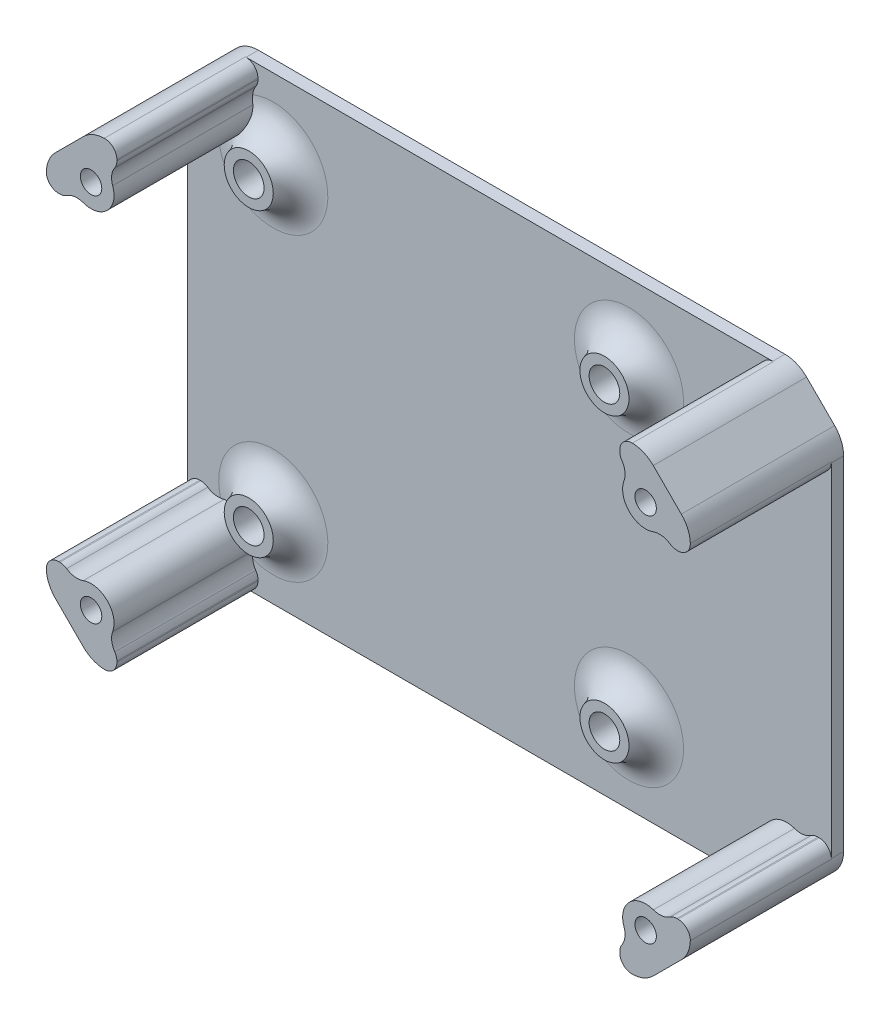
from build123d import *

# Parameters (mm, degrees)
EXTRUDE_1_DEPTH     = 25
SKETCH_2_R          = 1.75
CUT_EXTRUDE_1_DEPTH = 34
SHELL_1_T           = -2
FILLET_1_R          = 10
FILLET_2_R          = 3
FILLET_3_R          = 5
SKETCH_4_W          = 82
SKETCH_4_H          = 126.745531776
CUT_EXTRUDE_2_DEPTH = 23
FILLET_4_R          = 2
SKETCH_5_W          = 173.89587329
SKETCH_5_H          = 52
CUT_EXTRUDE_3_DEPTH = 23
FILLET_5_R          = 2
SKETCH_6_R          = 4
EXTRUDE_2_DEPTH     = 4
SKETCH_7_R          = 2.5
CUT_EXTRUDE_4_DEPTH = 6
FILLET_6_R          = 5


with BuildPart() as part:
    # Эскиз1 → Бобышка-Вытянуть1 (new body)
    with BuildSketch(Plane.XY):
        Polygon((-52.5, 30), (-45, 37.5), (45, 37.5), (52.5, 30), (52.5, -30), (45, -37.5), (-45, -37.5), (-52.5, -30), align=None)
    extrude(amount=EXTRUDE_1_DEPTH)

    # Эскиз2 → Вырез-Вытянуть1 (cut)
    with BuildSketch(Plane.XY.offset(25)):
        with Locations((-45.214466094, 30.214466094)):
            Circle(SKETCH_2_R)
        with Locations(Location((45.214466094, 30.214466094, 0), (0, 0, 180))):
            Circle(SKETCH_2_R)
        with Locations((45.214466094, -30.214466094)):
            Circle(SKETCH_2_R)
        with Locations(Location((-45.214466094, -30.214466094, 0), (0, 0, 180))):
            Circle(SKETCH_2_R)
    extrude(amount=-CUT_EXTRUDE_1_DEPTH, mode=Mode.SUBTRACT)

    # Оболочка1
    shell_1_openings = [part.faces().sort_by_distance(p)[0] for p in [
        (0, 0, 25),
    ]]
    offset(amount=SHELL_1_T, openings=shell_1_openings, kind=Kind.INTERSECTION)

    # Скругление1
    # the kernel refuses this fillet: 10 mm, written as the material it adds along each edge
    with BuildSketch(Plane(origin=(-45.74479618, -33.926776695, 2), x_dir=(0.7071067811865442, -0.7071067811865507, 0), z_dir=(0, 0, 1)), Plane(origin=(48.926776695, -30.74479618, 2), x_dir=(0.7071067811865482, 0.7071067811865467, 0), z_dir=(0, 0, 1)), Plane(origin=(45.74479618, 33.926776695, 2), x_dir=(-0.707106781186546, 0.7071067811865492, 0), z_dir=(0, 0, 1)), Plane(origin=(-48.926776695, 30.74479618, 2), x_dir=(-0.7071067811865508, -0.7071067811865444, 0), z_dir=(0, 0, 1))) as fillet_1_piece_1:
        with BuildLine():
            CenterArc((11.477032042, 3.794412555), FILLET_1_R, 183.312134334, 18.986942704)
            Line((1.493736012, 3.21665797), (1.294070091, 3.205102878))
            ThreePointArc((1.294070091, 3.205102878), (0.969771845, 1.504817982), (-0.12, 0.16))
            Line((-0.12, 0.16), (0, -0.2))
            ThreePointArc((0, -0.2), (1.112436867, -0.2), (2.039830568, -0.075888251))
            Line((2.039830568, -0.075888251), (2.224873734, 0))
        make_face()
    extrude(amount=23)
    with BuildSketch(Plane(origin=(-48.926776695, -30.74479618, 2), x_dir=(0.34351243985929386, 0.9391481265816991, 0), z_dir=(0, 0, 1)), Plane(origin=(45.74479618, -33.926776695, 2), x_dir=(-0.9391481265817004, 0.34351243985929, 0), z_dir=(0, 0, 1)), Plane(origin=(48.926776695, 30.74479618, 2), x_dir=(-0.3435124398592874, -0.9391481265817014, 0), z_dir=(0, 0, 1)), Plane(origin=(-45.74479618, 33.926776695, 2), x_dir=(0.9391481265817011, -0.34351243985928803, 0), z_dir=(0, 0, 1))) as fillet_1_piece_2:
        with BuildLine():
            CenterArc((8.275322434, 8.811292173), FILLET_1_R, 222.791938952, 18.986942704)
            Line((0.937067943, 2.017911495), (0.790302854, 1.882043882))
            ThreePointArc((0.790302854, 1.882043882), (0.287138375, 1.093191354), (-0.181395597, 0.084235607))
            Line((-0.181395597, 0.084235607), (0.094575114, -0.176225843))
            ThreePointArc((0.094575114, -0.176225843), (1.773283379, 0.245765435), (3.451991644, -0.176225843))
            Line((3.451991644, -0.176225843), (3.546566758, 0))
        make_face()
    extrude(amount=23)

    # Скругление2
    fillet_2_edges = [part.edges().sort_by_distance(p)[0] for p in [
        (-50.5, 29.171572875, 13.5),
        (-44.171572875, 35.5, 13.5),
        (-44.171572875, -35.5, 13.5),
        (-50.5, -29.171572875, 13.5),
        (44.171572875, -35.5, 13.5),
        (50.5, -29.171572875, 13.5),
        (50.5, 29.171572875, 13.5),
        (44.171572875, 35.5, 13.5),
    ]]
    fillet(fillet_2_edges, radius=FILLET_2_R)

    # Скругление3
    fillet_3_edges = [part.edges().sort_by_distance(p)[0] for p in [
        (45, 37.5, 12.5),
        (52.5, 30, 12.5),
        (52.5, -30, 12.5),
        (45, -37.5, 12.5),
        (-45, -37.5, 12.5),
        (-52.5, -30, 12.5),
        (-52.5, 30, 12.5),
        (-45, 37.5, 12.5),
    ]]
    fillet(fillet_3_edges, radius=FILLET_3_R)

    # Эскиз4 → Вырез-Вытянуть2 (cut)
    with BuildSketch(Plane.XY.offset(25)):
        Rectangle(SKETCH_4_W, SKETCH_4_H)
    extrude(amount=-CUT_EXTRUDE_2_DEPTH, mode=Mode.SUBTRACT)

    # Скругление4
    # the kernel refuses this fillet: 2 mm, written as the material it takes off along each edge
    with BuildSketch(Plane(origin=(41, -34.605706623, 2), x_dir=(0, -1, 0), z_dir=(0, 0, 1)), Plane(origin=(41, 34.605706623, 26.756559814), x_dir=(0, 1, 0), z_dir=(0, 0, -1))) as fillet_4_piece_1:
        with BuildLine():
            CenterArc((0.702623926, 2), FILLET_4_R, 235.828901177, 34.171098823)
            ThreePointArc((-0.420708294, 0.345272009), (-0.20250821, 0.18219615), (0, 0))
            Line((0, 0), (0.702623926, 0))
        make_face()
    extrude(amount=24.756559814, mode=Mode.SUBTRACT)
    with BuildSketch(Plane(origin=(41, -37.5, 30.118447555), x_dir=(0.9999997651545144, 0.0006853400003404547, 0), z_dir=(0, 0, -1)), Plane(origin=(-41, -37.5, 2), x_dir=(-0.9999997651545144, 0.0006853400003439418, 0), z_dir=(0, 0, 1)), Plane(origin=(41, 37.5, 2), x_dir=(0.9999997651545144, -0.0006853400003439394, 0), z_dir=(0, 0, 1))) as fillet_4_piece_2:
        with BuildLine():
            CenterArc((2.001370787, -1.999470741), FILLET_4_R, 88.681844886, 91.357422207)
            Line((0.001371257, -2.000841421), (-0.198628696, -2.000978489))
            Line((-0.198628696, -2.000978489), (-0.199999953, -0.000137068))
            Line((-0.199999953, -0.000137068), (-0.000137068, 0.199999953))
            ThreePointArc((-0.000137068, 0.199999953), (1.928794667, 0.201321927), (2.051979846, 0.199947074))
            Line((2.051979846, 0.199947074), (2.047379022, 0))
        make_face()
    extrude(amount=28.118447555, mode=Mode.SUBTRACT)
    with BuildSketch(Plane(origin=(-41, -34.605706623, 2), x_dir=(0, -1, 0), z_dir=(0, 0, 1))) as fillet_4_piece_3:
        with BuildLine():
            CenterArc((0.702623926, -2), FILLET_4_R, 90, 34.171098823)
            ThreePointArc((-0.420708294, -0.345272009), (-0.20250821, -0.18219615), (0, 0))
            Line((0, 0), (0.702623926, 0))
        make_face()
    extrude(amount=24.756559814, mode=Mode.SUBTRACT)
    with BuildSketch(Plane(origin=(-41, 34.605706623, 26.756559814), x_dir=(-0.6343994710235763, -0.7730053758965758, 0), z_dir=(0, 0, -1))) as fillet_4_piece_4:
        with BuildLine():
            CenterArc((0.72566687, 1.991754999), FILLET_4_R, 230.624541426, 34.171098823)
            Line((-0.543132072, 0.445744247), (0, 0))
            ThreePointArc((0, 0), (0.272125076, 0.012367502), (0.544250153, 0))
        make_face()
    extrude(amount=24.756559814, mode=Mode.SUBTRACT)
    with BuildSketch(Plane(origin=(-41, 37.5, 30.118447555), x_dir=(0, -1, 0), z_dir=(0, 0, -1))) as fillet_4_piece_5:
        with BuildLine():
            CenterArc((2.00084189, 2), FILLET_4_R, 178.642577793, 91.357422207)
            Line((0.001403151, 2.047378541), (-0.198540723, 2.052116395))
            ThreePointArc((-0.198540723, 2.052116395), (-0.2, 1.928932188), (-0.2, 0))
            Line((-0.2, 0), (0, -0.2))
            Line((0, -0.2), (2.00084189, -0.2))
            Line((2.00084189, -0.2), (2.00084189, 0))
        make_face()
    extrude(amount=28.118447555, mode=Mode.SUBTRACT)

    # Эскиз5 → Вырез-Вытянуть3 (cut)
    with BuildSketch(Plane.XY.offset(25)):
        Rectangle(SKETCH_5_W, SKETCH_5_H)
    extrude(amount=-CUT_EXTRUDE_3_DEPTH, mode=Mode.SUBTRACT)

    # Скругление5
    # the kernel refuses this fillet: 2 mm, written as the material it takes off along each edge
    with BuildSketch(Plane(origin=(49.605706623, -26, 26.756559814), x_dir=(1, 0, 0), z_dir=(0, 0, -1)), Plane(origin=(-49.605706623, -26, 2), x_dir=(-1, 0, 0), z_dir=(0, 0, 1))) as fillet_5_piece_1:
        with BuildLine():
            CenterArc((0.702623926, 2), FILLET_5_R, 235.828901177, 34.171098823)
            ThreePointArc((-0.420708294, 0.345272009), (-0.20250821, 0.18219615), (0, 0))
            Line((0, 0), (0.702623926, 0))
        make_face()
    extrude(amount=24.756559814, mode=Mode.SUBTRACT)
    with BuildSketch(Plane(origin=(52.5, -26, 2), x_dir=(-0.0006853400003439216, -0.9999997651545144, 0), z_dir=(0, 0, 1)), Plane(origin=(52.5, 26, 30.118447555), x_dir=(-0.0006853400003439287, 0.9999997651545144, 0), z_dir=(0, 0, -1)), Plane(origin=(-52.5, -26, 30.118447555), x_dir=(0.0006853400003404618, -0.9999997651545144, 0), z_dir=(0, 0, -1)), Plane(origin=(-52.5, 26, 2), x_dir=(0.0006853400003404558, 0.9999997651545144, 0), z_dir=(0, 0, 1))) as fillet_5_piece_2:
        with BuildLine():
            CenterArc((2.001370787, -1.999470741), FILLET_5_R, 88.681844886, 91.357422207)
            Line((0.001371257, -2.000841421), (-0.198628696, -2.000978489))
            Line((-0.198628696, -2.000978489), (-0.199999953, -0.000137068))
            Line((-0.199999953, -0.000137068), (-0.000137068, 0.199999953))
            ThreePointArc((-0.000137068, 0.199999953), (1.928794667, 0.201321927), (2.051979846, 0.199947074))
            Line((2.051979846, 0.199947074), (2.047379022, 0))
        make_face()
    extrude(amount=28.118447555, mode=Mode.SUBTRACT)
    with BuildSketch(Plane(origin=(49.605706623, 26, 26.756559814), x_dir=(-0.7730053758965695, 0.6343994710235842, 0), z_dir=(0, 0, -1))) as fillet_5_piece_3:
        with BuildLine():
            CenterArc((0.72566687, 1.991754999), FILLET_5_R, 230.624541426, 34.171098823)
            Line((-0.543132072, 0.445744247), (0, 0))
            ThreePointArc((0, 0), (0.272125076, 0.012367502), (0.544250153, 0))
        make_face()
    extrude(amount=24.756559814, mode=Mode.SUBTRACT)
    with BuildSketch(Plane(origin=(-49.605706623, 26, 2), x_dir=(-1, 0, 0), z_dir=(0, 0, 1))) as fillet_5_piece_4:
        with BuildLine():
            CenterArc((0.702623926, -2), FILLET_5_R, 90, 34.171098823)
            ThreePointArc((-0.420708294, -0.345272009), (-0.20250821, -0.18219615), (0, 0))
            Line((0, 0), (0.702623926, 0))
        make_face()
    extrude(amount=24.756559814, mode=Mode.SUBTRACT)

    # Эскиз6 → Бобышка-Вытянуть2 (add)
    with BuildSketch(Plane.XY.offset(2)):
        with Locations(Location((-38.5, 24.5, 0), (0, 0, 180))):
            Circle(SKETCH_6_R)
        with Locations(Location((19.5, 24.5, 0), (0, 0, 180))):
            Circle(SKETCH_6_R)
        with Locations(Location((19.5, -24.5, 0), (0, 0, 180))):
            Circle(SKETCH_6_R)
        with Locations(Location((-38.5, -24.5, 0), (0, 0, 180))):
            Circle(SKETCH_6_R)
    extrude(amount=EXTRUDE_2_DEPTH)

    # Эскиз7 → Вырез-Вытянуть4 (cut)
    with BuildSketch(Plane.XY.offset(6)):
        with Locations((-38.5, 24.5)):
            Circle(SKETCH_7_R)
        with Locations((19.5, 24.5)):
            Circle(SKETCH_7_R)
        with Locations((19.5, -24.5)):
            Circle(SKETCH_7_R)
        with Locations((-38.5, -24.5)):
            Circle(SKETCH_7_R)
    extrude(amount=-CUT_EXTRUDE_4_DEPTH, mode=Mode.SUBTRACT)

    # Скругление6
    # the kernel refuses this fillet: 5 mm, written as the material it adds along each edge
    with BuildSketch(Plane(origin=(-38.5, 24.5, 2), x_dir=(-1, 0, 0), z_dir=(0, 1, 0))) as fillet_6_piece_1_section:
        with BuildLine():
            CenterArc((8.898979486, 5), FILLET_6_R, 191.536959033, 78.463040967)
            Line((4, 4), (4, 0))
            Line((4, 0), (8.898979486, 0))
        make_face()
    fillet_6_piece_1 = revolve(axis=Axis((-38.5, 24.5, 2), (0, 0, 1)), mode=Mode.PRIVATE)
    fillet_6_piece_1 = fillet_6_piece_1 - Plane(origin=(-45.214466094, 30.214466094, 3.119270687), x_dir=(1, 0, 0), z_dir=(0, 0, 1)) * Cylinder(1.75, 36, mode=Mode.PRIVATE)
    add(fillet_6_piece_1)
    with BuildSketch(Plane(origin=(-38.5, -24.5, 2), x_dir=(-1, 0, 0), z_dir=(0, 1, 0))) as fillet_6_piece_2_section:
        with BuildLine():
            CenterArc((8.898979486, 5), FILLET_6_R, 191.536959033, 78.463040967)
            Line((4, 4), (4, 0))
            Line((4, 0), (8.898979486, 0))
        make_face()
    fillet_6_piece_2 = revolve(axis=Axis((-38.5, -24.5, 2), (0, 0, 1)), mode=Mode.PRIVATE)
    fillet_6_piece_2 = fillet_6_piece_2 - Plane(origin=(-45.214466094, -30.214466094, 3.119270687), x_dir=(-1, 0, 0), z_dir=(0, 0, 1)) * Cylinder(1.75, 36, mode=Mode.PRIVATE)
    add(fillet_6_piece_2)
    with BuildSketch(Plane(origin=(19.5, -24.5, 2), x_dir=(-1, 0, 0), z_dir=(0, 1, 0))) as fillet_6_piece_3:
        with BuildLine():
            CenterArc((8.898979486, 5), FILLET_6_R, 191.536959033, 78.463040967)
            Line((4, 4), (4, 0))
            Line((4, 0), (8.898979486, 0))
        make_face()
    revolve(axis=Axis((19.5, -24.5, 2), (0, 0, 1)))
    with BuildSketch(Plane(origin=(19.5, 24.5, 2), x_dir=(-1, 0, 0), z_dir=(0, 1, 0))) as fillet_6_piece_4:
        with BuildLine():
            CenterArc((8.898979486, 5), FILLET_6_R, 191.536959033, 78.463040967)
            Line((4, 4), (4, 0))
            Line((4, 0), (8.898979486, 0))
        make_face()
    revolve(axis=Axis((19.5, 24.5, 2), (0, 0, 1)))


solid = part.part
